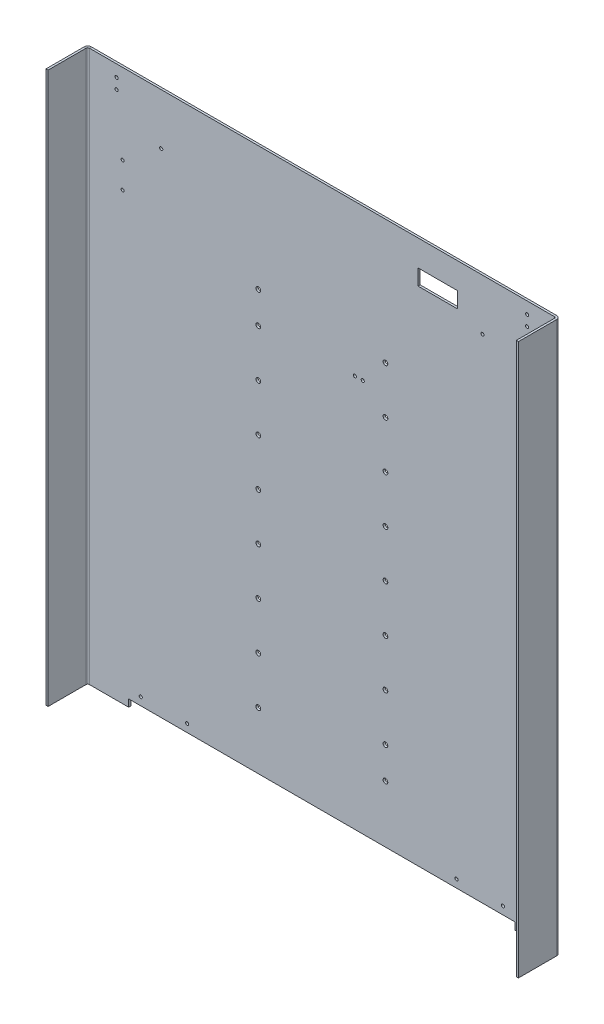
from build123d import *

# Parameters (mm, degrees)
SKETCH1_W                      = 600
SKETCH1_H                      = 700
BASE_FLANGE1_DEPTH             = 2.7
EDGE_FLANGE1_STRIP_W           = 14.8
EDGE_FLANGE1_STRIP_H           = 2.7
EDGE_FLANGE1_STRIP_CUT_DEPTH   = 700
EDGE_FLANGE1_STRIP_2_W         = 14.8
EDGE_FLANGE1_STRIP_2_H         = 2.7
EDGE_FLANGE1_STRIP_CUT_2_DEPTH = 700
EDGE_FLANGE1_DEPTH             = 700
EDGE_FLANGE1_BEND_DEPTH        = 700
CUT_EXTRUDE1_REACH             = 925.326
SKETCH12_W                     = 50
SKETCH12_H                     = 20
SKETCH13_W                     = 490.6
SKETCH13_H                     = 9.2
CUT_EXTRUDE2_DEPTH             = 924.476583352
CUT_EXTRUDE6_REACH             = 925.477
SKETCH17_R                     = 2
CUT_EXTRUDE7_START             = -2.7
CUT_EXTRUDE7_OUTLINE_R         = 2
CUT_EXTRUDE7_DEPTH             = 2.7
CUT_EXTRUDE10_START            = -2.7
CUT_EXTRUDE10_OUTLINE_R        = 3
CUT_EXTRUDE10_DEPTH            = 2.7


# Read off the part's stored shape, not the designer's step: Cut-Extrude7, Cut-Extrude10
# Sheet-metal steps are written as plain solids
with BuildPart() as part:
    # Sketch1 → Base-Flange1 (new body)
    with BuildSketch(Plane.XY):
        with Locations((300, 350)):
            Rectangle(SKETCH1_W, SKETCH1_H)
    extrude(amount=-BASE_FLANGE1_DEPTH)

    # Edge-Flange1 strip (across the edge) → Edge-Flange1 strip cut (cut)
    with BuildSketch(Plane(origin=(600, 0, 0), x_dir=(-1, 0, 0), z_dir=(0, 1, 0))):
        with Locations((-2.7, -1.35)):
            Rectangle(EDGE_FLANGE1_STRIP_W, EDGE_FLANGE1_STRIP_H)
    extrude(amount=EDGE_FLANGE1_STRIP_CUT_DEPTH, mode=Mode.SUBTRACT)

    # Edge-Flange1 strip 2 (across the edge) → Edge-Flange1 strip cut 2 (cut)
    with BuildSketch(Plane.XZ.offset(-700)):
        with Locations((-2.7, -1.35)):
            Rectangle(EDGE_FLANGE1_STRIP_2_W, EDGE_FLANGE1_STRIP_2_H)
    extrude(amount=EDGE_FLANGE1_STRIP_CUT_2_DEPTH, mode=Mode.SUBTRACT)

    # Edge-Flange1 section (across the edge) → Edge-Flange1 (add)
    with BuildSketch(Plane(origin=(600, 0, 0), x_dir=(-1, 0, 0), z_dir=(0, 1, 0))):
        with BuildLine():
            Line((0, 2), (0, 50.3))
            Line((0, 50.3), (2.7, 50.3))
            Line((2.7, 50.3), (2.7, 2))
            ThreePointArc((2.7, 2), (3.285786438, 0.585786438), (4.7, 0))
            Line((4.7, 0), (4.7, -2.7))
            ThreePointArc((4.7, -2.7), (1.376598128, -1.323401872), (0, 2))
        make_face()
    extrude(amount=EDGE_FLANGE1_DEPTH)

    # Edge-Flange1 section 2 (across the edge) → Edge-Flange1 bend (add)
    with BuildSketch(Plane.XZ.offset(-700)):
        with BuildLine():
            Line((0, 2), (0, 50.3))
            Line((0, 50.3), (2.7, 50.3))
            Line((2.7, 50.3), (2.7, 2))
            ThreePointArc((2.7, 2), (3.285786438, 0.585786438), (4.7, 0))
            Line((4.7, 0), (4.7, -2.7))
            ThreePointArc((4.7, -2.7), (1.376598128, -1.323401872), (0, 2))
        make_face()
    extrude(amount=EDGE_FLANGE1_BEND_DEPTH)

    # Sketch12 → Cut-Extrude1 (cut, up to next)
    with BuildSketch(Plane.XY, mode=Mode.PRIVATE) as cut_extrude1_sk1:
        with Locations((447.3, 657)):
            Rectangle(SKETCH12_W, SKETCH12_H)
    cut_extrude1_tool1 = extrude(cut_extrude1_sk1.sketch, amount=-CUT_EXTRUDE1_REACH, mode=Mode.PRIVATE) & part.part
    add(cut_extrude1_tool1.solids().sort_by_distance((447.3, 657, 0))[0], mode=Mode.SUBTRACT)

    # Sketch13 → Cut-Extrude2 (cut, through all)
    with BuildSketch(Plane(origin=(0, 0, -2.7), x_dir=(-1, 0, 0), z_dir=(0, 0, -1))):
        with Locations((-300, 4.6)):
            Rectangle(SKETCH13_W, SKETCH13_H)
    extrude(amount=-CUT_EXTRUDE2_DEPTH, mode=Mode.SUBTRACT)

    # Sketch17 → Cut-Extrude6 (cut, up to next)
    with BuildSketch(Plane(origin=(0, 0, -2.7), x_dir=(-1, 0, 0), z_dir=(0, 0, -1)), mode=Mode.PRIVATE) as cut_extrude6_sk1:
        with Locations((-560.7, 685)):
            Circle(SKETCH17_R)
    cut_extrude6_tool1 = extrude(cut_extrude6_sk1.sketch, amount=-CUT_EXTRUDE6_REACH, mode=Mode.PRIVATE) & part.part
    # Sketch17 → Cut-Extrude6 (cut, up to next)
    with BuildSketch(Plane(origin=(0, 0, -2.7), x_dir=(-1, 0, 0), z_dir=(0, 0, -1)), mode=Mode.PRIVATE) as cut_extrude6_sk2:
        with Locations((-560.7, 671.7)):
            Circle(SKETCH17_R)
    cut_extrude6_tool2 = extrude(cut_extrude6_sk2.sketch, amount=-CUT_EXTRUDE6_REACH, mode=Mode.PRIVATE) & part.part
    # Sketch17 → Cut-Extrude6 (cut, up to next)
    with BuildSketch(Plane(origin=(0, 0, -2.7), x_dir=(-1, 0, 0), z_dir=(0, 0, -1)), mode=Mode.PRIVATE) as cut_extrude6_sk3:
        with Locations((-504, 635)):
            Circle(SKETCH17_R)
    cut_extrude6_tool3 = extrude(cut_extrude6_sk3.sketch, amount=-CUT_EXTRUDE6_REACH, mode=Mode.PRIVATE) & part.part
    # Sketch17 → Cut-Extrude6 (cut, up to next)
    with BuildSketch(Plane(origin=(0, 0, -2.7), x_dir=(-1, 0, 0), z_dir=(0, 0, -1)), mode=Mode.PRIVATE) as cut_extrude6_sk4:
        with Locations((-553, 598)):
            Circle(SKETCH17_R)
    cut_extrude6_tool4 = extrude(cut_extrude6_sk4.sketch, amount=-CUT_EXTRUDE6_REACH, mode=Mode.PRIVATE) & part.part
    # Sketch17 → Cut-Extrude6 (cut, up to next)
    with BuildSketch(Plane(origin=(0, 0, -2.7), x_dir=(-1, 0, 0), z_dir=(0, 0, -1)), mode=Mode.PRIVATE) as cut_extrude6_sk5:
        with Locations((-553, 565)):
            Circle(SKETCH17_R)
    cut_extrude6_tool5 = extrude(cut_extrude6_sk5.sketch, amount=-CUT_EXTRUDE6_REACH, mode=Mode.PRIVATE) & part.part
    # Sketch17 → Cut-Extrude6 (cut, up to next)
    with BuildSketch(Plane(origin=(0, 0, -2.7), x_dir=(-1, 0, 0), z_dir=(0, 0, -1)), mode=Mode.PRIVATE) as cut_extrude6_sk6:
        with Locations((-530, 19.2)):
            Circle(SKETCH17_R)
    cut_extrude6_tool6 = extrude(cut_extrude6_sk6.sketch, amount=-CUT_EXTRUDE6_REACH, mode=Mode.PRIVATE) & part.part
    # Sketch17 → Cut-Extrude6 (cut, up to next)
    with BuildSketch(Plane(origin=(0, 0, -2.7), x_dir=(-1, 0, 0), z_dir=(0, 0, -1)), mode=Mode.PRIVATE) as cut_extrude6_sk7:
        with Locations((-471, 19.2)):
            Circle(SKETCH17_R)
    cut_extrude6_tool7 = extrude(cut_extrude6_sk7.sketch, amount=-CUT_EXTRUDE6_REACH, mode=Mode.PRIVATE) & part.part
    # Sketch17 → Cut-Extrude6 (cut, up to next)
    with BuildSketch(Plane(origin=(0, 0, -2.7), x_dir=(-1, 0, 0), z_dir=(0, 0, -1)), mode=Mode.PRIVATE) as cut_extrude6_sk8:
        with Locations((-129, 19.2)):
            Circle(SKETCH17_R)
    cut_extrude6_tool8 = extrude(cut_extrude6_sk8.sketch, amount=-CUT_EXTRUDE6_REACH, mode=Mode.PRIVATE) & part.part
    # Sketch17 → Cut-Extrude6 (cut, up to next)
    with BuildSketch(Plane(origin=(0, 0, -2.7), x_dir=(-1, 0, 0), z_dir=(0, 0, -1)), mode=Mode.PRIVATE) as cut_extrude6_sk9:
        with Locations((-70, 19.2)):
            Circle(SKETCH17_R)
    cut_extrude6_tool9 = extrude(cut_extrude6_sk9.sketch, amount=-CUT_EXTRUDE6_REACH, mode=Mode.PRIVATE) & part.part
    # Sketch17 → Cut-Extrude6 (cut, up to next)
    with BuildSketch(Plane(origin=(0, 0, -2.7), x_dir=(-1, 0, 0), z_dir=(0, 0, -1)), mode=Mode.PRIVATE) as cut_extrude6_sk10:
        with Locations((-47, 565)):
            Circle(SKETCH17_R)
    cut_extrude6_tool10 = extrude(cut_extrude6_sk10.sketch, amount=-CUT_EXTRUDE6_REACH, mode=Mode.PRIVATE) & part.part
    # Sketch17 → Cut-Extrude6 (cut, up to next)
    with BuildSketch(Plane(origin=(0, 0, -2.7), x_dir=(-1, 0, 0), z_dir=(0, 0, -1)), mode=Mode.PRIVATE) as cut_extrude6_sk11:
        with Locations((-47, 598)):
            Circle(SKETCH17_R)
    cut_extrude6_tool11 = extrude(cut_extrude6_sk11.sketch, amount=-CUT_EXTRUDE6_REACH, mode=Mode.PRIVATE) & part.part
    # Sketch17 → Cut-Extrude6 (cut, up to next)
    with BuildSketch(Plane(origin=(0, 0, -2.7), x_dir=(-1, 0, 0), z_dir=(0, 0, -1)), mode=Mode.PRIVATE) as cut_extrude6_sk12:
        with Locations((-96, 635)):
            Circle(SKETCH17_R)
    cut_extrude6_tool12 = extrude(cut_extrude6_sk12.sketch, amount=-CUT_EXTRUDE6_REACH, mode=Mode.PRIVATE) & part.part
    # Sketch17 → Cut-Extrude6 (cut, up to next)
    with BuildSketch(Plane(origin=(0, 0, -2.7), x_dir=(-1, 0, 0), z_dir=(0, 0, -1)), mode=Mode.PRIVATE) as cut_extrude6_sk13:
        with Locations((-39.3, 671.7)):
            Circle(SKETCH17_R)
    cut_extrude6_tool13 = extrude(cut_extrude6_sk13.sketch, amount=-CUT_EXTRUDE6_REACH, mode=Mode.PRIVATE) & part.part
    # Sketch17 → Cut-Extrude6 (cut, up to next)
    with BuildSketch(Plane(origin=(0, 0, -2.7), x_dir=(-1, 0, 0), z_dir=(0, 0, -1)), mode=Mode.PRIVATE) as cut_extrude6_sk14:
        with Locations((-39.3, 685)):
            Circle(SKETCH17_R)
    cut_extrude6_tool14 = extrude(cut_extrude6_sk14.sketch, amount=-CUT_EXTRUDE6_REACH, mode=Mode.PRIVATE) & part.part
    add(cut_extrude6_tool1.solids().sort_by_distance((560.7, 685, -2.7))[0], mode=Mode.SUBTRACT)
    add(cut_extrude6_tool2.solids().sort_by_distance((560.7, 671.7, -2.7))[0], mode=Mode.SUBTRACT)
    add(cut_extrude6_tool3.solids().sort_by_distance((504, 635, -2.7))[0], mode=Mode.SUBTRACT)
    add(cut_extrude6_tool4.solids().sort_by_distance((553, 598, -2.7))[0], mode=Mode.SUBTRACT)
    add(cut_extrude6_tool5.solids().sort_by_distance((553, 565, -2.7))[0], mode=Mode.SUBTRACT)
    add(cut_extrude6_tool6.solids().sort_by_distance((530, 19.2, -2.7))[0], mode=Mode.SUBTRACT)
    add(cut_extrude6_tool7.solids().sort_by_distance((471, 19.2, -2.7))[0], mode=Mode.SUBTRACT)
    add(cut_extrude6_tool8.solids().sort_by_distance((129, 19.2, -2.7))[0], mode=Mode.SUBTRACT)
    add(cut_extrude6_tool9.solids().sort_by_distance((70, 19.2, -2.7))[0], mode=Mode.SUBTRACT)
    add(cut_extrude6_tool10.solids().sort_by_distance((47, 565, -2.7))[0], mode=Mode.SUBTRACT)
    add(cut_extrude6_tool11.solids().sort_by_distance((47, 598, -2.7))[0], mode=Mode.SUBTRACT)
    add(cut_extrude6_tool12.solids().sort_by_distance((96, 635, -2.7))[0], mode=Mode.SUBTRACT)
    add(cut_extrude6_tool13.solids().sort_by_distance((39.3, 671.7, -2.7))[0], mode=Mode.SUBTRACT)
    add(cut_extrude6_tool14.solids().sort_by_distance((39.3, 685, -2.7))[0], mode=Mode.SUBTRACT)

    # Cut-Extrude7 outline → Cut-Extrude7 (cut)
    with BuildSketch(Plane.XY.offset(CUT_EXTRUDE7_START)):
        with Locations((352, 508)):
            Circle(CUT_EXTRUDE7_OUTLINE_R)
        with Locations((580, 505)):
            Circle(CUT_EXTRUDE7_OUTLINE_R)
        with Locations((580, 525)):
            Circle(CUT_EXTRUDE7_OUTLINE_R)
        with Locations((342, 508)):
            Circle(CUT_EXTRUDE7_OUTLINE_R)
    extrude(amount=CUT_EXTRUDE7_DEPTH, mode=Mode.SUBTRACT)

    # Cut-Extrude10 outline → Cut-Extrude10 (cut)
    with BuildSketch(Plane.XY.offset(CUT_EXTRUDE10_START)):
        with Locations((219.3, 541.9)):
            Circle(CUT_EXTRUDE10_OUTLINE_R)
        with Locations((380.8, 121.9)):
            Circle(CUT_EXTRUDE10_OUTLINE_R)
        with Locations((219.3, 261.9)):
            Circle(CUT_EXTRUDE10_OUTLINE_R)
        with Locations((219.3, 201.9)):
            Circle(CUT_EXTRUDE10_OUTLINE_R)
        with Locations((380.8, 181.9)):
            Circle(CUT_EXTRUDE10_OUTLINE_R)
        with Locations((380.8, 241.9)):
            Circle(CUT_EXTRUDE10_OUTLINE_R)
        with Locations((380.8, 301.9)):
            Circle(CUT_EXTRUDE10_OUTLINE_R)
        with Locations((219.3, 141.9)):
            Circle(CUT_EXTRUDE10_OUTLINE_R)
        with Locations((219.3, 81.9)):
            Circle(CUT_EXTRUDE10_OUTLINE_R)
        with Locations((380.8, 81.9)):
            Circle(CUT_EXTRUDE10_OUTLINE_R)
        with Locations((219.3, 321.9)):
            Circle(CUT_EXTRUDE10_OUTLINE_R)
        with Locations((380.8, 361.9)):
            Circle(CUT_EXTRUDE10_OUTLINE_R)
        with Locations((219.3, 381.9)):
            Circle(CUT_EXTRUDE10_OUTLINE_R)
        with Locations((380.8, 421.9)):
            Circle(CUT_EXTRUDE10_OUTLINE_R)
        with Locations((219.3, 441.9)):
            Circle(CUT_EXTRUDE10_OUTLINE_R)
        with Locations((380.8, 481.9)):
            Circle(CUT_EXTRUDE10_OUTLINE_R)
        with Locations((219.3, 501.9)):
            Circle(CUT_EXTRUDE10_OUTLINE_R)
        with Locations((380.8, 541.9)):
            Circle(CUT_EXTRUDE10_OUTLINE_R)
    extrude(amount=CUT_EXTRUDE10_DEPTH, mode=Mode.SUBTRACT)


solid = part.part
